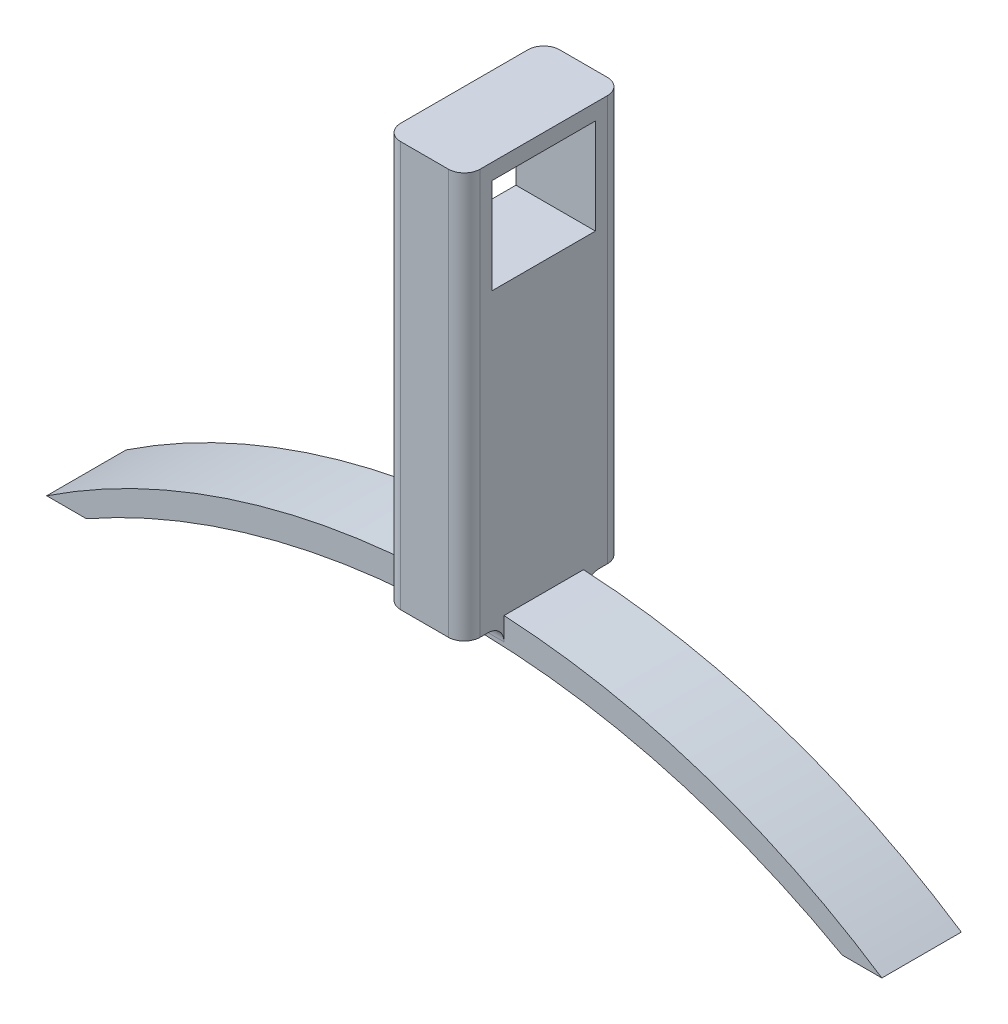
from build123d import *

# Parameters (mm, degrees)
BOSS_EXTRUDE1_DEPTH = 10
SCALE1_SCALE        = 0.5
SKETCH4_W           = 5
SKETCH4_H           = 10
BOSS_EXTRUDE4_DEPTH = 25
SKETCH5_W           = 5
SKETCH5_H           = 10
BOSS_EXTRUDE5_DEPTH = 0.5
FILLET1_R           = 1
SKETCH6_W           = 6.5
SKETCH6_H           = 6
CUT_EXTRUDE1_DEPTH  = 49.530155881


with BuildPart() as part:
    # Sketch1 → Boss-Extrude1 (new body)
    with BuildSketch(Plane.XY):
        with BuildLine():
            Line((0, 0), (5, 0))
            ThreePointArc((5, 0), (52.528561354, 12.453541306), (100.057122708, 0))
            Line((100.057122708, 0), (105.057122708, 0))
            ThreePointArc((105.057122708, 0), (52.528561354, 15.847728612), (0, 0))
        make_face()
    extrude(amount=BOSS_EXTRUDE1_DEPTH)


with BuildPart() as part_1:
    # Scale1: scaled about (52.528561354, 9.724546383, 5)
    add(part.part.scale(SCALE1_SCALE).moved(Location((26.264280677, 4.862273191, 2.5))))



with BuildPart() as body_2:
    # Sketch4 → Boss-Extrude4 (new body)
    with BuildSketch(Plane(origin=(0, 12.786137497, 0), x_dir=(1, 0, 0), z_dir=(0, 1, 0))):
        with Locations((52.528561354, -5)):
            Rectangle(SKETCH4_W, SKETCH4_H)
    extrude(amount=BOSS_EXTRUDE4_DEPTH)


with BuildPart() as part_2:
    add(part_1.part)

    add(body_2.part)  # Boss-Extrude5 merges body 2
    # Sketch5 → Boss-Extrude5 (add)
    with BuildSketch(Plane.XZ.offset(-12.786137497)):
        with Locations((52.528561354, 5)):
            Rectangle(SKETCH5_W, SKETCH5_H)
    extrude(amount=BOSS_EXTRUDE5_DEPTH)

    # Fillet1
    fillet1_edges = [part_2.edges().sort_by_distance(p)[0] for p in [
        (52.528561354, 12.286137497, 2.5),
        (52.528561354, 12.286137497, 7.5),
        (50.028561354, 25.036137497, 0),
        (55.028561354, 25.036137497, 0),
        (55.028561354, 25.036137497, 10),
        (50.028561354, 25.036137497, 10),
    ]]
    fillet(fillet1_edges, radius=FILLET1_R)

    # Sketch6 → Cut-Extrude1 (cut, through all)
    with BuildSketch(Plane(origin=(55.028561354, 0, 0), x_dir=(0, 0, -1), z_dir=(1, 0, 0))):
        with Locations((-5, 33.786137497)):
            Rectangle(SKETCH6_W, SKETCH6_H)
    extrude(amount=-CUT_EXTRUDE1_DEPTH, mode=Mode.SUBTRACT)


solid = part_2.part
